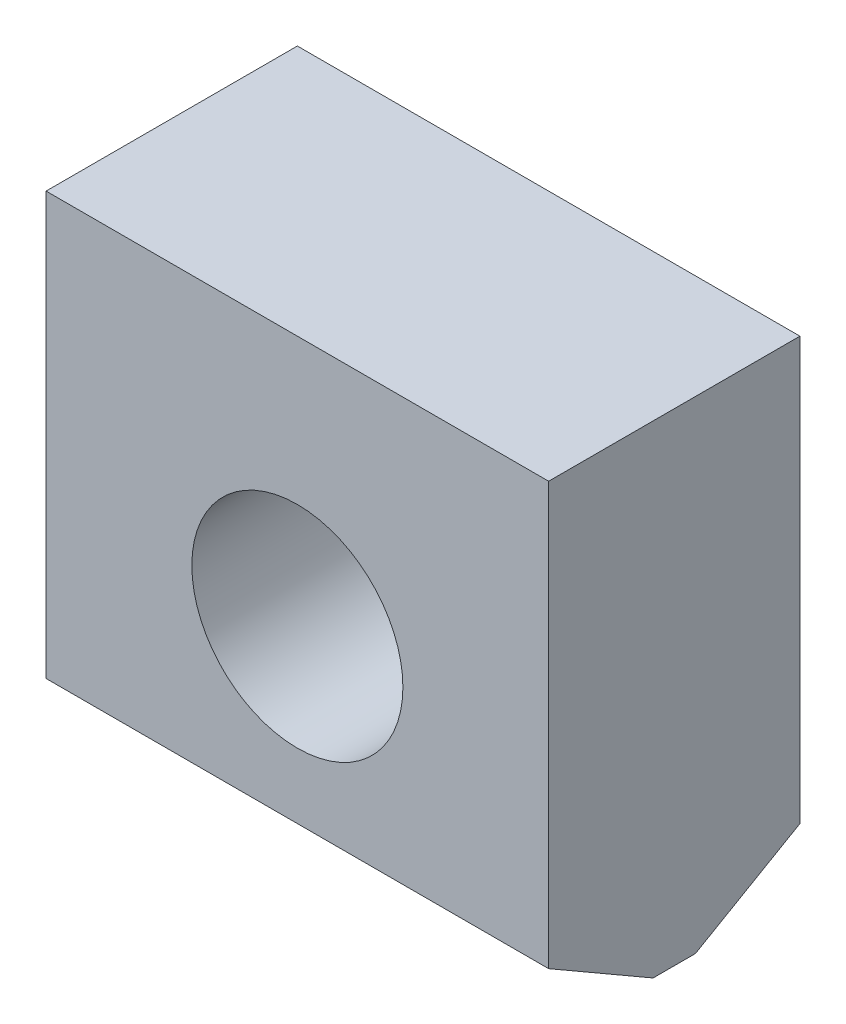
from build123d import *

# Parameters (mm, degrees)
SKETCH_1_W          = 50
SKETCH_1_H          = 48
EXTRUDE_1_DEPTH     = 25
SKETCH_2_R          = 10.5
CUT_EXTRUDE_1_DEPTH = 74.681748079
CHAMFER_1_SIZE      = 6
CHAMFER_1_SIZE2     = 10.392304845
CHAMFER_2_SIZE      = 6
CHAMFER_2_SIZE2     = 10.392304845


with BuildPart() as part:
    # Эскиз1 → Бобышка-Вытянуть1 (new body)
    with BuildSketch(Plane.XY):
        with Locations((25, 24)):
            Rectangle(SKETCH_1_W, SKETCH_1_H)
    extrude(amount=EXTRUDE_1_DEPTH)

    # Эскиз2 → Вырез-Вытянуть1 (cut, through all)
    with BuildSketch(Plane.XY.offset(25)):
        with Locations((25, 23)):
            Circle(SKETCH_2_R)
    extrude(amount=-CUT_EXTRUDE_1_DEPTH, mode=Mode.SUBTRACT)

    # Фаска1
    chamfer_1_edges = [part.edges().sort_by_distance(p)[0] for p in [
        (25, 0, 0),
    ]]
    chamfer_1_side = [part.faces().sort_by_distance(p)[0] for p in [
        (25, 0.693108938, 0),
    ]]
    chamfer(chamfer_1_edges, length=CHAMFER_1_SIZE, length2=CHAMFER_1_SIZE2, reference=chamfer_1_side[0])

    # Фаска2
    chamfer_2_edges = [part.edges().sort_by_distance(p)[0] for p in [
        (25, 0, 25),
    ]]
    chamfer_2_side = [part.faces().sort_by_distance(p)[0] for p in [
        (25, 0.693108938, 25),
    ]]
    chamfer(chamfer_2_edges, length=CHAMFER_2_SIZE, length2=CHAMFER_2_SIZE2, reference=chamfer_2_side[0])


solid = part.part
